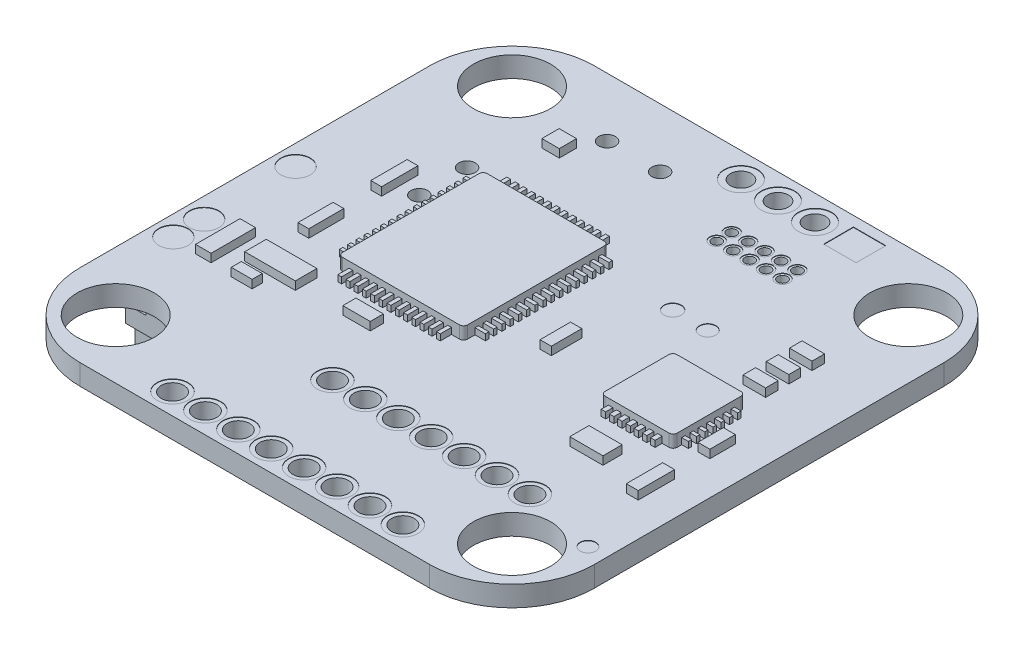
from build123d import *

# Parameters (mm, degrees)
SKETCH1_W           = 31.75
SKETCH1_H           = 31.75
BOSS_EXTRUDE1_DEPTH = 1.27
FILLET1_R           = 5.08
SKETCH2_R           = 2.38125
SKETCH2_R_2         = 0.513227476
CUT_EXTRUDE1_DEPTH  = 2540
SKETCH3_W           = 7.734024407
SKETCH3_H           = 8.94246572
SKETCH3_W_2         = 4.455512607
SKETCH3_H_2         = 4.44056294
BOSS_EXTRUDE2_DEPTH = 0.762
SKETCH4_W           = 0.665951654
SKETCH4_H           = 2.247586831
SKETCH4_H_2         = 2.164342875
SKETCH4_W_2         = 0.957305502
SKETCH4_H_3         = 2.747050572
SKETCH4_W_3         = 3.121648377
SKETCH4_H_4         = 1.331903307
SKETCH4_W_4         = 1.290281329
SKETCH4_H_5         = 0.624329675
SKETCH4_W_5         = 1.692581605
SKETCH4_H_6         = 0.81110746
SKETCH4_W_6         = 0.6963202
SKETCH4_H_7         = 1.884160541
SKETCH4_W_7         = 1.073669656
SKETCH4_H_8         = 1.064960306
SKETCH4_W_8         = 1.3926404
SKETCH4_H_9         = 0.778240224
SKETCH4_H_10        = 0.737280212
SKETCH4_W_9         = 2.048000588
SKETCH4_H_11        = 1.185705265
SKETCH4_W_10        = 0.737280212
SKETCH4_H_12        = 1.57031373
SKETCH4_H_13        = 2.247586832
BOSS_EXTRUDE3_DEPTH = 0.508
SKETCH5_W           = 0.913629892
SKETCH5_H           = 0.213828273
SKETCH5_H_2         = 0.213828272
SKETCH5_W_2         = 0.233267206
SKETCH5_H_3         = 1.069141363
SKETCH5_H_4         = 1.088580297
SKETCH5_W_3         = 0.819753322
SKETCH5_W_4         = 0.754173056
SKETCH5_H_5         = 0.210176866
SKETCH5_W_5         = 0.278716129
SKETCH5_H_6         = 0.676104487
SKETCH5_H_7         = 0.721819977
BOSS_EXTRUDE4_DEPTH = 0.381
SKETCH6_R           = 1.027987033
SKETCH6_R_2         = 0.426271727
SKETCH6_R_3         = 0.905059833
SKETCH6_R_4         = 0.504587533
SKETCH6_R_5         = 0.534547711
SKETCH6_R_6         = 0.478723023
SKETCH6_R_7         = 0.952228923
SKETCH6_W           = 1.997854961
SKETCH6_H           = 1.831367048
CUT_EXTRUDE2_DEPTH  = 0.0254
FILLET2_R           = 0.254
SKETCH7_W           = 14.734180338
SKETCH7_H           = 15.857973755
SKETCH7_W_2         = 4.578070361
SKETCH7_H_2         = 7.36709017
BOSS_EXTRUDE5_DEPTH = 1.905
SKETCH8_W           = 14.882958641
SKETCH8_H           = 1.379983815
CUT_EXTRUDE3_DEPTH  = 13.97
SKETCH10_W          = 6.798713526
SKETCH10_H          = 1.33450517
CUT_EXTRUDE4_DEPTH  = 3.81
CUT_EXTRUDE5_DEPTH  = 1.27
SKETCH12_W          = 3.03840442
SKETCH12_H          = 3.829222009
SKETCH12_H_2        = 3.995709922
CUT_EXTRUDE6_DEPTH  = 1.27
SKETCH13_W          = 1.664879134
SKETCH13_H          = 9.656298979
CUT_EXTRUDE7_DEPTH  = 0.239775287
SKETCH14_W          = 1.415147264
SKETCH14_H          = 1.456769243
SKETCH14_H_2        = 1.623257156
SKETCH14_W_2        = 1.540013199
SKETCH14_H_3        = 0.832439567
SKETCH14_H_4        = 0.998927481
CUT_EXTRUDE8_DEPTH  = 1.27
BOSS_EXTRUDE6_DEPTH = 4.572
SKETCH16_W          = 0.680432362
SKETCH16_H          = 0.441361532
SKETCH16_W_2        = 0.643652234
SKETCH16_W_3        = 0.555541417
SKETCH16_W_4        = 0.604797181
CUT_EXTRUDE9_DEPTH  = 4.572
SKETCH17_W          = 0.555541417
SKETCH17_H          = 0.734843187
SKETCH17_W_2        = 0.604797181
CUT_EXTRUDE10_DEPTH = 3.048
SKETCH18_W          = 0.555541417
SKETCH18_H          = 0.712608625
SKETCH18_W_2        = 0.604797181
SKETCH18_H_2        = 1.628576262
CUT_EXTRUDE11_DEPTH = 1.27
SKETCH19_W          = 6.160052797
SKETCH19_H          = 2.78867255
BOSS_EXTRUDE7_DEPTH = 1.27
SKETCH20_W          = 2.081098918
SKETCH20_H          = 1.207037372
SKETCH20_W_2        = 2.830294529
SKETCH20_H_2        = 1.664879135
SKETCH20_W_3        = 0.624329675
SKETCH20_H_3        = 1.852178037
SKETCH20_W_4        = 0.665951653
SKETCH20_W_5        = 1.165415394
SKETCH20_H_4        = 0.790817589
SKETCH20_W_6        = 1.123615853
SKETCH20_H_5        = 0.653138375
SKETCH20_H_6        = 0.799491643
SKETCH20_H_7        = 0.752462723
SKETCH20_W_7        = 0.677623672
SKETCH20_H_8        = 1.387353146
SKETCH20_W_8        = 0.649208544
SKETCH20_W_9        = 2.205964853
SKETCH20_H_9        = 1.081665165
SKETCH20_W_10       = 0.58951107
SKETCH20_H_10       = 1.457896526
SKETCH20_W_11       = 0.681919343
SKETCH20_H_11       = 1.551954366
SKETCH20_W_12       = 1.222751924
SKETCH20_H_12       = 0.634890423
SKETCH20_H_13       = 0.705433802
BOSS_EXTRUDE8_DEPTH = 0.762
SKETCH21_R          = 0.698228923
SKETCH21_R_2        = 0.648998018
SKETCH21_R_3        = 0.301620328
CUT_EXTRUDE12_DEPTH = 16.002


with BuildPart() as part:
    # Sketch1 → Boss-Extrude1 (new body)
    with BuildSketch(Plane(origin=(0, 0, 0), x_dir=(1, 0, 0), z_dir=(0, 1, 0))):
        Rectangle(SKETCH1_W, SKETCH1_H)
    extrude(amount=BOSS_EXTRUDE1_DEPTH)

    # Fillet1
    fillet1_edges = [part.edges().sort_by_distance(p)[0] for p in [
        (-15.875, 0.635, -15.875),
        (15.875, 0.635, -15.875),
        (15.875, 0.635, 15.875),
        (-15.875, 0.635, 15.875),
    ]]
    fillet(fillet1_edges, radius=FILLET1_R)

    # Sketch2 → Cut-Extrude1 (cut)
    with BuildSketch(Plane(origin=(0, 1.27, 0), x_dir=(1, 0, 0), z_dir=(0, 1, 0))):
        with Locations(Location((12.235378749, 12.235378749, 0), (0, 0, 270))):
            Circle(SKETCH2_R)
        with Locations(Location((-12.235378749, 12.235378749, 0), (0, 0, 270))):
            Circle(SKETCH2_R)
        with Locations(Location((-12.235378749, -12.235378749, 0), (0, 0, 270))):
            Circle(SKETCH2_R)
        with Locations(Location((12.235378749, -12.235378749, 0), (0, 0, 270))):
            Circle(SKETCH2_R)
        with Locations(Location((-6.365121013, 12.235378749, 0), (0, 0, 270))):
            Circle(SKETCH2_R_2)
        with Locations(Location((-3.088320071, 12.235378749, 0), (0, 0, 270))):
            Circle(SKETCH2_R_2)
        with Locations(Location((-9.273281849, 6.498808589, 0), (0, 0, 270))):
            Circle(SKETCH2_R_2)
        with Locations(Location((-9.273281849, 3.549687741, 0), (0, 0, 270))):
            Circle(SKETCH2_R_2)
    extrude(amount=-CUT_EXTRUDE1_DEPTH, mode=Mode.SUBTRACT)

    # Sketch3 → Boss-Extrude2 (add)
    with BuildSketch(Plane(origin=(0, 1.27, 0), x_dir=(1, 0, 0), z_dir=(0, 1, 0))):
        with Locations((-3.955858025, 1.568424552)):
            Rectangle(SKETCH3_W, SKETCH3_H)
        with Locations((9.941217082, 0)):
            Rectangle(SKETCH3_W_2, SKETCH3_H_2)
    extrude(amount=BOSS_EXTRUDE2_DEPTH)

    # Sketch4 → Boss-Extrude3 (add)
    with BuildSketch(Plane(origin=(0, 1.27, 0), x_dir=(1, 0, 0), z_dir=(0, 1, 0))):
        with Locations((-10.717659427, 3.454624204)):
            Rectangle(SKETCH4_W, SKETCH4_H)
        with Locations((-10.717659427, -1.082171437)):
            Rectangle(SKETCH4_W, SKETCH4_H_2)
        with Locations((-12.569837464, -5.119503338)):
            Rectangle(SKETCH4_W_2, SKETCH4_H_3)
        with Locations((-9.573055023, -4.703283555)):
            Rectangle(SKETCH4_W_3, SKETCH4_H_4)
        with Locations((-10.072518762, -6.305729722)):
            Rectangle(SKETCH4_W_4, SKETCH4_H_5)
        with Locations((-4.377267482, -4.817483436)):
            Rectangle(SKETCH4_W_5, SKETCH4_H_6)
        with Locations((3.035201688, -0.013833282)):
            Rectangle(SKETCH4_W_6, SKETCH4_H_7)
        with Locations((-7.475396006, 10.390009707)):
            Rectangle(SKETCH4_W_7, SKETCH4_H_8)
        with Locations((11.53440413, 6.683128642)):
            Rectangle(SKETCH4_W_8, SKETCH4_H_9)
        with Locations((11.53440413, 5.229048224)):
            Rectangle(SKETCH4_W_8, SKETCH4_H_10)
        with Locations((11.53440413, 3.815927818)):
            Rectangle(SKETCH4_W_8, SKETCH4_H_9)
        with Locations((9.814083636, -4.630184533)):
            Rectangle(SKETCH4_W_9, SKETCH4_H_11)
        with Locations((13.418564672, -0.785156865)):
            Rectangle(SKETCH4_W_10, SKETCH4_H_12)
        with Locations((13.418564672, -4.869771468)):
            Rectangle(SKETCH4_W_10, SKETCH4_H_13)
    extrude(amount=BOSS_EXTRUDE3_DEPTH)

    # Sketch5 → Boss-Extrude4 (add)
    with BuildSketch(Plane(origin=(0, 1.27, 0), x_dir=(1, 0, 0), z_dir=(0, 1, 0))):
        with Locations((0.099544847, 5.02121391)):
            Rectangle(SKETCH5_W, SKETCH5_H)
        with Locations((0.099544847, 5.529205613)):
            Rectangle(SKETCH5_W, SKETCH5_H_2)
        with Locations((-8.006490575, 5.529205613)):
            Rectangle(SKETCH5_W, SKETCH5_H_2)
        with Locations((-8.006490575, 5.02121391)):
            Rectangle(SKETCH5_W, SKETCH5_H)
        with Locations((0.099544847, 4.513222205)):
            Rectangle(SKETCH5_W, SKETCH5_H)
        with Locations((-8.006490575, 4.513222205)):
            Rectangle(SKETCH5_W, SKETCH5_H)
        with Locations((0.099544847, 4.005230501)):
            Rectangle(SKETCH5_W, SKETCH5_H)
        with Locations((-8.006490575, 4.005230501)):
            Rectangle(SKETCH5_W, SKETCH5_H)
        with Locations((0.099544847, 3.497238798)):
            Rectangle(SKETCH5_W, SKETCH5_H_2)
        with Locations((-8.006490575, 3.497238798)):
            Rectangle(SKETCH5_W, SKETCH5_H_2)
        with Locations((0.099544847, 2.989247095)):
            Rectangle(SKETCH5_W, SKETCH5_H)
        with Locations((-8.006490575, 2.989247095)):
            Rectangle(SKETCH5_W, SKETCH5_H)
        with Locations((0.099544847, 2.481255391)):
            Rectangle(SKETCH5_W, SKETCH5_H)
        with Locations((-8.006490575, 2.481255391)):
            Rectangle(SKETCH5_W, SKETCH5_H)
        with Locations((0.099544847, 1.973263687)):
            Rectangle(SKETCH5_W, SKETCH5_H)
        with Locations((-8.006490575, 1.973263687)):
            Rectangle(SKETCH5_W, SKETCH5_H)
        with Locations((0.099544847, 1.465271983)):
            Rectangle(SKETCH5_W, SKETCH5_H_2)
        with Locations((-8.006490575, 1.465271983)):
            Rectangle(SKETCH5_W, SKETCH5_H_2)
        with Locations((0.099544847, 0.957280279)):
            Rectangle(SKETCH5_W, SKETCH5_H_2)
        with Locations((-8.006490575, 0.957280279)):
            Rectangle(SKETCH5_W, SKETCH5_H_2)
        with Locations((0.099544847, 0.449288576)):
            Rectangle(SKETCH5_W, SKETCH5_H)
        with Locations((-8.006490575, 0.449288576)):
            Rectangle(SKETCH5_W, SKETCH5_H)
        with Locations((0.099544847, -0.058703129)):
            Rectangle(SKETCH5_W, SKETCH5_H)
        with Locations((-8.006490575, -0.058703129)):
            Rectangle(SKETCH5_W, SKETCH5_H)
        with Locations((0.099544847, -0.566694832)):
            Rectangle(SKETCH5_W, SKETCH5_H_2)
        with Locations((-8.006490575, -0.566694832)):
            Rectangle(SKETCH5_W, SKETCH5_H_2)
        with Locations((0.099544847, -1.074686536)):
            Rectangle(SKETCH5_W, SKETCH5_H_2)
        with Locations((-8.006490575, -1.074686536)):
            Rectangle(SKETCH5_W, SKETCH5_H_2)
        with Locations((0.099544847, -1.58267824)):
            Rectangle(SKETCH5_W, SKETCH5_H)
        with Locations((-8.006490575, -1.58267824)):
            Rectangle(SKETCH5_W, SKETCH5_H)
        with Locations((0.099544847, -2.090669944)):
            Rectangle(SKETCH5_W, SKETCH5_H)
        with Locations((-8.006490575, -2.090669944)):
            Rectangle(SKETCH5_W, SKETCH5_H)
        with Locations((-6.536263349, 6.306762968)):
            Rectangle(SKETCH5_W_2, SKETCH5_H_3)
        with Locations((-7.044263349, 6.306762968)):
            Rectangle(SKETCH5_W_2, SKETCH5_H_3)
        with Locations((-7.044263349, -3.05308369)):
            Rectangle(SKETCH5_W_2, SKETCH5_H_4)
        with Locations((-6.536263349, -3.05308369)):
            Rectangle(SKETCH5_W_2, SKETCH5_H_4)
        with Locations((-6.028263349, 6.306762968)):
            Rectangle(SKETCH5_W_2, SKETCH5_H_3)
        with Locations((-6.028263349, -3.05308369)):
            Rectangle(SKETCH5_W_2, SKETCH5_H_4)
        with Locations((-5.520263349, 6.306762968)):
            Rectangle(SKETCH5_W_2, SKETCH5_H_3)
        with Locations((-5.520263349, -3.05308369)):
            Rectangle(SKETCH5_W_2, SKETCH5_H_4)
        with Locations((-5.012263349, 6.306762968)):
            Rectangle(SKETCH5_W_2, SKETCH5_H_3)
        with Locations((-5.012263349, -3.05308369)):
            Rectangle(SKETCH5_W_2, SKETCH5_H_4)
        with Locations((-4.504263349, 6.306762968)):
            Rectangle(SKETCH5_W_2, SKETCH5_H_3)
        with Locations((-4.504263349, -3.05308369)):
            Rectangle(SKETCH5_W_2, SKETCH5_H_4)
        with Locations((-3.996263349, 6.306762968)):
            Rectangle(SKETCH5_W_2, SKETCH5_H_3)
        with Locations((-3.996263349, -3.05308369)):
            Rectangle(SKETCH5_W_2, SKETCH5_H_4)
        with Locations((-3.488263349, 6.306762968)):
            Rectangle(SKETCH5_W_2, SKETCH5_H_3)
        with Locations((-3.488263349, -3.05308369)):
            Rectangle(SKETCH5_W_2, SKETCH5_H_4)
        with Locations((-2.980263349, 6.306762968)):
            Rectangle(SKETCH5_W_2, SKETCH5_H_3)
        with Locations((-2.980263349, -3.05308369)):
            Rectangle(SKETCH5_W_2, SKETCH5_H_4)
        with Locations((-2.472263349, 6.306762968)):
            Rectangle(SKETCH5_W_2, SKETCH5_H_3)
        with Locations((-2.472263349, -3.05308369)):
            Rectangle(SKETCH5_W_2, SKETCH5_H_4)
        with Locations((-1.964263349, 6.306762968)):
            Rectangle(SKETCH5_W_2, SKETCH5_H_3)
        with Locations((-1.964263349, -3.05308369)):
            Rectangle(SKETCH5_W_2, SKETCH5_H_4)
        with Locations((-1.456263349, 6.306762968)):
            Rectangle(SKETCH5_W_2, SKETCH5_H_3)
        with Locations((-1.456263349, -3.05308369)):
            Rectangle(SKETCH5_W_2, SKETCH5_H_4)
        with Locations((-0.948263349, 6.306762968)):
            Rectangle(SKETCH5_W_2, SKETCH5_H_3)
        with Locations((-0.948263349, -3.05308369)):
            Rectangle(SKETCH5_W_2, SKETCH5_H_4)
        with Locations((7.755699681, -1.07467824)):
            Rectangle(SKETCH5_W_3, SKETCH5_H)
        with Locations((7.755699681, -1.58267824)):
            Rectangle(SKETCH5_W_3, SKETCH5_H)
        with Locations((12.198762686, -1.584503943)):
            Rectangle(SKETCH5_W_4, SKETCH5_H_5)
        with Locations((12.198762686, -1.076503943)):
            Rectangle(SKETCH5_W_4, SKETCH5_H_5)
        with Locations((7.755699681, -0.56667824)):
            Rectangle(SKETCH5_W_3, SKETCH5_H)
        with Locations((12.198762686, -0.568503943)):
            Rectangle(SKETCH5_W_4, SKETCH5_H_5)
        with Locations((7.755699681, -0.05867824)):
            Rectangle(SKETCH5_W_3, SKETCH5_H)
        with Locations((12.198762686, -0.060503943)):
            Rectangle(SKETCH5_W_4, SKETCH5_H_5)
        with Locations((7.755699681, 0.449321761)):
            Rectangle(SKETCH5_W_3, SKETCH5_H)
        with Locations((12.198762686, 0.447496057)):
            Rectangle(SKETCH5_W_4, SKETCH5_H_5)
        with Locations((7.755699681, 0.957321761)):
            Rectangle(SKETCH5_W_3, SKETCH5_H)
        with Locations((12.198762686, 0.955496057)):
            Rectangle(SKETCH5_W_4, SKETCH5_H_5)
        with Locations((7.755699681, 1.465321761)):
            Rectangle(SKETCH5_W_3, SKETCH5_H)
        with Locations((12.198762686, 1.463496057)):
            Rectangle(SKETCH5_W_4, SKETCH5_H_5)
        with Locations((8.812934407, -2.321808051)):
            Rectangle(SKETCH5_W_5, SKETCH5_H_6)
        with Locations((8.304934407, 2.227259539)):
            Rectangle(SKETCH5_W_5, SKETCH5_H_7)
        with Locations((8.304934407, -2.321808051)):
            Rectangle(SKETCH5_W_5, SKETCH5_H_6)
        with Locations((8.812934407, 2.227259539)):
            Rectangle(SKETCH5_W_5, SKETCH5_H_7)
        with Locations((9.320934407, -2.321808051)):
            Rectangle(SKETCH5_W_5, SKETCH5_H_6)
        with Locations((9.320934407, 2.227259539)):
            Rectangle(SKETCH5_W_5, SKETCH5_H_7)
        with Locations((9.828934407, -2.321808051)):
            Rectangle(SKETCH5_W_5, SKETCH5_H_6)
        with Locations((9.828934407, 2.227259539)):
            Rectangle(SKETCH5_W_5, SKETCH5_H_7)
        with Locations((10.336934407, -2.321808051)):
            Rectangle(SKETCH5_W_5, SKETCH5_H_6)
        with Locations((10.336934407, 2.227259539)):
            Rectangle(SKETCH5_W_5, SKETCH5_H_7)
        with Locations((10.844934407, -2.321808051)):
            Rectangle(SKETCH5_W_5, SKETCH5_H_6)
        with Locations((10.844934407, 2.227259539)):
            Rectangle(SKETCH5_W_5, SKETCH5_H_7)
        with Locations((11.352934407, -2.321808051)):
            Rectangle(SKETCH5_W_5, SKETCH5_H_6)
        with Locations((11.352934407, 2.227259539)):
            Rectangle(SKETCH5_W_5, SKETCH5_H_7)
    extrude(amount=BOSS_EXTRUDE4_DEPTH)

    # Sketch6 → Cut-Extrude2 (cut)
    with BuildSketch(Plane(origin=(0, 1.27, 0), x_dir=(1, 0, 0), z_dir=(0, 1, 0))):
        with Locations(Location((4.370307728, 14.338771544, 0), (0, 0, 270))):
            Circle(SKETCH6_R)
        with Locations(Location((2.084307728, 14.338771544, 0), (0, 0, 270))):
            Circle(SKETCH6_R)
        with Locations(Location((-0.201692272, 14.338771544, 0), (0, 0, 270))):
            Circle(SKETCH6_R)
        with Locations(Location((6.409784667, 11.217123168, 0), (0, 0, 270))):
            Circle(SKETCH6_R_2)
        with Locations(Location((6.409784667, 10.293398218, 0), (0, 0, 270))):
            Circle(SKETCH6_R_2)
        with Locations(Location((5.393784667, 11.217123168, 0), (0, 0, 270))):
            Circle(SKETCH6_R_2)
        with Locations(Location((5.393784667, 10.293398218, 0), (0, 0, 270))):
            Circle(SKETCH6_R_2)
        with Locations(Location((4.377784667, 11.217123168, 0), (0, 0, 270))):
            Circle(SKETCH6_R_2)
        with Locations(Location((4.377784667, 10.293398218, 0), (0, 0, 270))):
            Circle(SKETCH6_R_2)
        with Locations(Location((3.361784667, 11.217123168, 0), (0, 0, 270))):
            Circle(SKETCH6_R_2)
        with Locations(Location((3.361784667, 10.293398218, 0), (0, 0, 270))):
            Circle(SKETCH6_R_2)
        with Locations(Location((2.345784667, 11.217123168, 0), (0, 0, 270))):
            Circle(SKETCH6_R_2)
        with Locations(Location((2.345784667, 10.293398218, 0), (0, 0, 270))):
            Circle(SKETCH6_R_2)
        with Locations(Location((-14.634699345, 1.269473008, 0), (0, 0, 270))):
            Circle(SKETCH6_R_3)
        with Locations(Location((-14.634699345, -4.375397019, 0), (0, 0, 270))):
            Circle(SKETCH6_R_3)
        with Locations(Location((-14.634699345, -6.273101018, 0), (0, 0, 270))):
            Circle(SKETCH6_R_3)
        with Locations(Location((6.855725392, 5.229884908, 0), (0, 0, 270))):
            Circle(SKETCH6_R_4)
        with Locations(Location((4.691431935, 5.229884908, 0), (0, 0, 270))):
            Circle(SKETCH6_R_5)
        with Locations(Location((14.725883417, -10.038221661, 0), (0, 0, 270))):
            Circle(SKETCH6_R_6)
        with Locations(Location((10.121840972, -9.015101117, 0), (0, 0, 270))):
            Circle(SKETCH6_R_7)
        with Locations(Location((8.089840972, -9.015101117, 0), (0, 0, 270))):
            Circle(SKETCH6_R_7)
        with Locations(Location((6.057840972, -9.015101117, 0), (0, 0, 270))):
            Circle(SKETCH6_R_7)
        with Locations(Location((4.025840972, -9.015101117, 0), (0, 0, 270))):
            Circle(SKETCH6_R_7)
        with Locations(Location((1.993840972, -9.015101117, 0), (0, 0, 270))):
            Circle(SKETCH6_R_7)
        with Locations(Location((-0.038159028, -9.015101117, 0), (0, 0, 270))):
            Circle(SKETCH6_R_7)
        with Locations(Location((-2.070159028, -9.015101117, 0), (0, 0, 270))):
            Circle(SKETCH6_R_7)
        with Locations(Location((7.824931931, -14.563562525, 0), (0, 0, 270))):
            Circle(SKETCH6_R_7)
        with Locations(Location((5.792931931, -14.563562525, 0), (0, 0, 270))):
            Circle(SKETCH6_R_7)
        with Locations(Location((3.760931931, -14.563562525, 0), (0, 0, 270))):
            Circle(SKETCH6_R_7)
        with Locations(Location((1.728931931, -14.563562525, 0), (0, 0, 270))):
            Circle(SKETCH6_R_7)
        with Locations(Location((-0.303068069, -14.563562525, 0), (0, 0, 270))):
            Circle(SKETCH6_R_7)
        with Locations(Location((-2.335068069, -14.563562525, 0), (0, 0, 270))):
            Circle(SKETCH6_R_7)
        with Locations(Location((-4.367068069, -14.563562525, 0), (0, 0, 270))):
            Circle(SKETCH6_R_7)
        with Locations(Location((-6.399068069, -14.563562525, 0), (0, 0, 270))):
            Circle(SKETCH6_R_7)
        with Locations((6.826004451, 14.338771544)):
            Rectangle(SKETCH6_W, SKETCH6_H)
    extrude(amount=-CUT_EXTRUDE2_DEPTH, mode=Mode.SUBTRACT)

    # Fillet2
    fillet2_edges = [part.edges().sort_by_distance(p)[0] for p in [
        (-7.822870229, 1.651, -6.039657412),
        (-7.822870229, 1.651, 2.902808308),
        (-0.088845822, 1.651, 2.902808308),
        (-0.088845822, 1.651, -6.039657412),
        (7.713460778, 1.651, -2.22028147),
        (7.713460778, 1.651, 2.22028147),
        (12.168973385, 1.651, 2.22028147),
        (12.168973385, 1.651, -2.22028147),
    ]]
    fillet(fillet2_edges, radius=FILLET2_R)

    # Sketch7 → Boss-Extrude5 (add)
    with BuildSketch(Plane.XZ):
        with Locations((5.223558284, -0.853250556)):
            Rectangle(SKETCH7_W, SKETCH7_H)
        with Locations((-13.089938565, -5.098692349)):
            Rectangle(SKETCH7_W_2, SKETCH7_H_2)
    extrude(amount=BOSS_EXTRUDE5_DEPTH)

    # Sketch8 → Cut-Extrude3 (cut)
    with BuildSketch(Plane(origin=(12.590648453, 0, 0), x_dir=(0, 0, -1), z_dir=(1, 0, 0))):
        with Locations((0.833352515, -0.929767195)):
            Rectangle(SKETCH8_W, SKETCH8_H)
    extrude(amount=-CUT_EXTRUDE3_DEPTH, mode=Mode.SUBTRACT)

    # Sketch10 → Cut-Extrude4 (cut)
    with BuildSketch(Plane.ZY.offset(15.378973745)):
        with Locations((-5.097593598, -0.899949488)):
            Rectangle(SKETCH10_W, SKETCH10_H)
    extrude(amount=-CUT_EXTRUDE4_DEPTH, mode=Mode.SUBTRACT)

    # Sketch11 → Cut-Extrude5 (cut)
    with BuildSketch(Plane.XZ.offset(1.905)):
        Polygon((12.590648453, 3.973420502), (7.75794531, 1.103415111), (7.75794531, -5.717764563), (12.590648453, -7.603711228), align=None)
    extrude(amount=-CUT_EXTRUDE5_DEPTH, mode=Mode.SUBTRACT)

    # Sketch12 → Cut-Extrude6 (cut)
    with BuildSketch(Plane.XZ.offset(0.239775287)):
        with Locations((4.953015425, -1.373525285)):
            Rectangle(SKETCH12_W, SKETCH12_H)
        with Locations((4.953015425, -5.82707697)):
            Rectangle(SKETCH12_W, SKETCH12_H_2)
    extrude(amount=-CUT_EXTRUDE6_DEPTH, mode=Mode.SUBTRACT)

    # Sketch13 → Cut-Extrude7 (cut)
    with BuildSketch(Plane.XZ.offset(0.239775287)):
        with Locations((11.758208886, -2.830294529)):
            Rectangle(SKETCH13_W, SKETCH13_H)
    extrude(amount=-CUT_EXTRUDE7_DEPTH, mode=Mode.SUBTRACT)

    # Sketch14 → Cut-Extrude8 (cut)
    with BuildSketch(Plane.XZ.offset(1.905)):
        with Locations((-11.508477016, -3.433813214)):
            Rectangle(SKETCH14_W, SKETCH14_H)
        with Locations((-11.508477016, -7.013303353)):
            Rectangle(SKETCH14_W, SKETCH14_H_2)
        with Locations((-14.109850664, -2.705428594)):
            Rectangle(SKETCH14_W_2, SKETCH14_H_3)
        with Locations((-14.109850664, -7.61682204)):
            Rectangle(SKETCH14_W_2, SKETCH14_H_4)
    extrude(amount=-CUT_EXTRUDE8_DEPTH, mode=Mode.SUBTRACT)

    # Sketch15 → Boss-Extrude6 (add)
    with BuildSketch(Plane(origin=(0, 0, 0), x_dir=(-1, 0, 0), z_dir=(0, -1, 0))):
        Polygon((9.302512163, -1.706501113), (9.302512163, -0.964616609), (15.461197982, -0.964616609), (15.461197982, -8.414357038), (9.302512163, -8.414357038), (9.302512163, -7.700065996), (10.884147341, -7.700065996), (10.884147341, -1.706501113), align=None)
    extrude(amount=BOSS_EXTRUDE6_DEPTH)

    # Sketch16 → Cut-Extrude9 (cut)
    # profile 1 of 3: a face of its own
    with BuildSketch(Plane.ZY.offset(15.461197982)):
        Polygon((5.23495092, -3.826913807), (7.461685575, -3.826913807), (7.461685575, -0.867969527), (1.994071145, -0.867969527), (1.994071145, -3.826913807), (4.149937154, -3.826913807), (4.149937154, -4.264732145), (5.23495092, -4.264732145), align=None)
        with Locations((3.276409122, -2.903867422)):
            Rectangle(SKETCH16_W, SKETCH16_H, mode=Mode.SUBTRACT)
        with Locations((6.200429272, -2.903867422)):
            Rectangle(SKETCH16_W_2, SKETCH16_H, mode=Mode.SUBTRACT)
    # profile 2 of 3: a face of its own
    with BuildSketch(Plane.ZY.offset(15.461197982)):
        with Locations((1.242387317, -2.903867422)):
            Rectangle(SKETCH16_W_3, SKETCH16_H)
    # profile 3 of 3: a face of its own
    with BuildSketch(Plane.ZY.offset(15.461197982)):
        with Locations((8.111958448, -2.903867422)):
            Rectangle(SKETCH16_W_4, SKETCH16_H)
    extrude(amount=-CUT_EXTRUDE9_DEPTH, mode=Mode.SUBTRACT)

    # Sketch17 → Cut-Extrude10 (cut)
    with BuildSketch(Plane.ZY.offset(15.461197982)):
        with Locations((1.242387317, -3.491969782)):
            Rectangle(SKETCH17_W, SKETCH17_H)
        with Locations((8.111958448, -3.491969782)):
            Rectangle(SKETCH17_W_2, SKETCH17_H)
    extrude(amount=-CUT_EXTRUDE10_DEPTH, mode=Mode.SUBTRACT)

    # Sketch18 → Cut-Extrude11 (cut)
    with BuildSketch(Plane.ZY.offset(15.461197982)):
        with Locations((1.242387317, -4.215695688)):
            Rectangle(SKETCH18_W, SKETCH18_H)
        with Locations((8.111958448, -4.215695688)):
            Rectangle(SKETCH18_W_2, SKETCH18_H)
        with Locations((1.242387317, -0.814288131)):
            Rectangle(SKETCH18_W, SKETCH18_H_2)
        with Locations((8.111958448, -0.814288131)):
            Rectangle(SKETCH18_W_2, SKETCH18_H_2)
    extrude(amount=-CUT_EXTRUDE11_DEPTH, mode=Mode.SUBTRACT)

    # Sketch19 → Boss-Extrude7 (add)
    with BuildSketch(Plane(origin=(0, 0, 0), x_dir=(-1, 0, 0), z_dir=(0, -1, 0))):
        with Locations((4.640850587, 12.049562735)):
            Rectangle(SKETCH19_W, SKETCH19_H)
    extrude(amount=BOSS_EXTRUDE7_DEPTH)

    # Sketch20 → Boss-Extrude8 (add)
    with BuildSketch(Plane(origin=(0, 0, 0), x_dir=(-1, 0, 0), z_dir=(0, -1, 0))):
        with Locations((7.013303353, 6.055997851)):
            Rectangle(SKETCH20_W, SKETCH20_H)
        with Locations((5.181936306, 2.497318702)):
            Rectangle(SKETCH20_W_2, SKETCH20_H_2)
        with Locations((4.57841762, 6.98208687)):
            Rectangle(SKETCH20_W_3, SKETCH20_H_3)
        with Locations((3.433813215, 6.98208687)):
            Rectangle(SKETCH20_W_4, SKETCH20_H_3)
        with Locations((3.683545085, 9.260890185)):
            Rectangle(SKETCH20_W_5, SKETCH20_H_4)
        with Locations((9.614765783, 0.131272575)):
            Rectangle(SKETCH20_W_6, SKETCH20_H_5)
        with Locations((9.469000077, -3.837607083)):
            Rectangle(SKETCH20_W_2, SKETCH20_H_6)
        with Locations((9.469000077, -5.483619289)):
            Rectangle(SKETCH20_W_2, SKETCH20_H_7)
        with Locations((5.229394293, -1.215744783)):
            Rectangle(SKETCH20_W_7, SKETCH20_H_8)
        with Locations((4.091393313, -1.215744783)):
            Rectangle(SKETCH20_W_8, SKETCH20_H_8)
        with Locations((4.869771468, -3.978693844)):
            Rectangle(SKETCH20_W_9, SKETCH20_H_9)
        with Locations((2.806081853, -4.166809524)):
            Rectangle(SKETCH20_W_10, SKETCH20_H_10)
        with Locations((5.909165801, -8.21129666)):
            Rectangle(SKETCH20_W_11, SKETCH20_H_11)
        with Locations((7.825594298, -9.704464876)):
            Rectangle(SKETCH20_W_12, SKETCH20_H_12)
        with Locations((7.825594298, -10.656800509)):
            Rectangle(SKETCH20_W_12, SKETCH20_H_13)
    extrude(amount=BOSS_EXTRUDE8_DEPTH)

    # Sketch21 → Cut-Extrude12 (cut)
    with BuildSketch(Plane(origin=(0, 1.2446, 0), x_dir=(1, 0, 0), z_dir=(0, 1, 0))):
        with Locations(Location((-6.399068069, -14.563562525, 0), (0, 0, 270))):
            Circle(SKETCH21_R)
        with Locations(Location((-4.367068069, -14.563562525, 0), (0, 0, 270))):
            Circle(SKETCH21_R)
        with Locations(Location((-0.303068069, -14.563562525, 0), (0, 0, 270))):
            Circle(SKETCH21_R)
        with Locations(Location((-2.335068069, -14.563562525, 0), (0, 0, 270))):
            Circle(SKETCH21_R)
        with Locations(Location((1.728931931, -14.563562525, 0), (0, 0, 270))):
            Circle(SKETCH21_R)
        with Locations(Location((3.760931931, -14.563562525, 0), (0, 0, 270))):
            Circle(SKETCH21_R)
        with Locations(Location((5.792931931, -14.563562525, 0), (0, 0, 270))):
            Circle(SKETCH21_R)
        with Locations(Location((7.824931931, -14.563562525, 0), (0, 0, 270))):
            Circle(SKETCH21_R)
        with Locations(Location((-0.038159028, -9.015101117, 0), (0, 0, 270))):
            Circle(SKETCH21_R)
        with Locations(Location((-2.070159028, -9.015101117, 0), (0, 0, 270))):
            Circle(SKETCH21_R)
        with Locations(Location((1.993840972, -9.015101117, 0), (0, 0, 270))):
            Circle(SKETCH21_R)
        with Locations(Location((4.025840972, -9.015101117, 0), (0, 0, 270))):
            Circle(SKETCH21_R)
        with Locations(Location((6.057840972, -9.015101117, 0), (0, 0, 270))):
            Circle(SKETCH21_R)
        with Locations(Location((8.089840972, -9.015101117, 0), (0, 0, 270))):
            Circle(SKETCH21_R)
        with Locations(Location((10.121840972, -9.015101117, 0), (0, 0, 270))):
            Circle(SKETCH21_R)
        with Locations(Location((4.370307728, 14.338771544, 0), (0, 0, 270))):
            Circle(SKETCH21_R_2)
        with Locations(Location((2.084307728, 14.338771544, 0), (0, 0, 270))):
            Circle(SKETCH21_R_2)
        with Locations(Location((-0.201692272, 14.338771544, 0), (0, 0, 270))):
            Circle(SKETCH21_R_2)
        with Locations(Location((6.409784667, 11.217123168, 0), (0, 0, 270))):
            Circle(SKETCH21_R_3)
        with Locations(Location((6.409784667, 10.293398218, 0), (0, 0, 270))):
            Circle(SKETCH21_R_3)
        with Locations(Location((5.393784667, 11.217123168, 0), (0, 0, 270))):
            Circle(SKETCH21_R_3)
        with Locations(Location((5.393784667, 10.293398218, 0), (0, 0, 270))):
            Circle(SKETCH21_R_3)
        with Locations(Location((4.377784667, 11.217123168, 0), (0, 0, 270))):
            Circle(SKETCH21_R_3)
        with Locations(Location((4.377784667, 10.293398218, 0), (0, 0, 270))):
            Circle(SKETCH21_R_3)
        with Locations(Location((3.361784667, 11.217123168, 0), (0, 0, 270))):
            Circle(SKETCH21_R_3)
        with Locations(Location((3.361784667, 10.293398218, 0), (0, 0, 270))):
            Circle(SKETCH21_R_3)
        with Locations(Location((2.345784667, 11.217123168, 0), (0, 0, 270))):
            Circle(SKETCH21_R_3)
        with Locations(Location((2.345784667, 10.293398218, 0), (0, 0, 270))):
            Circle(SKETCH21_R_3)
    extrude(amount=-CUT_EXTRUDE12_DEPTH, mode=Mode.SUBTRACT)


solid = part.part
